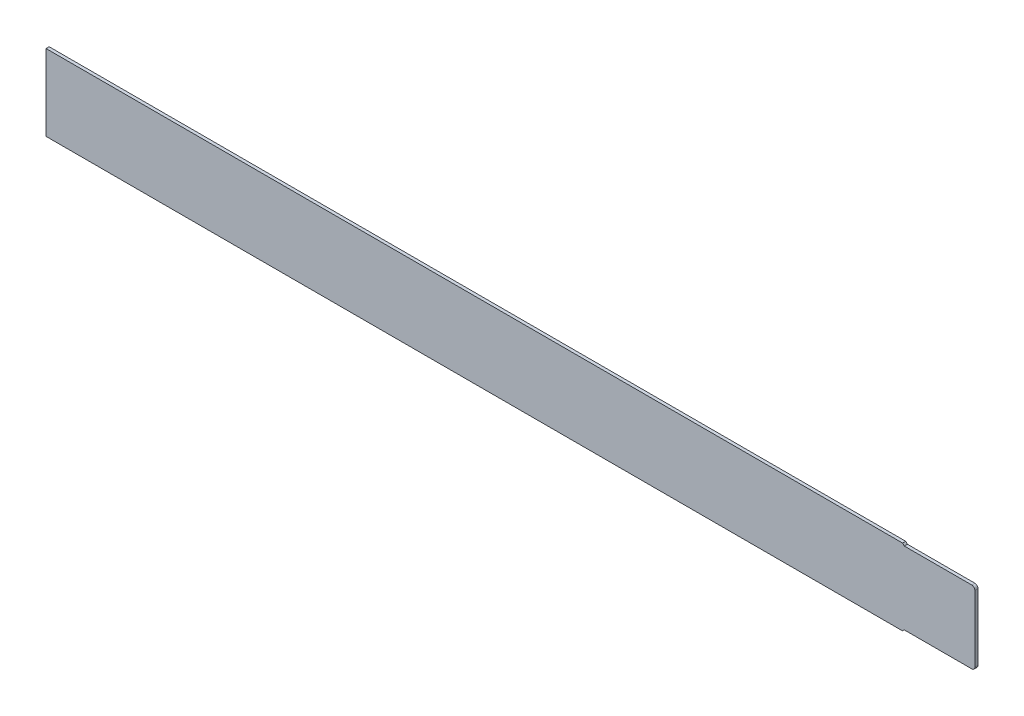
from build123d import *

# Parameters (mm, degrees)
BOSS_EXTRUDE1_DEPTH = 0.3
FILLET1_R           = 0.3
CHAMFER1_SIZE       = 0.2


with BuildPart() as part:
    # Sketch1 → Boss-Extrude1 (new body)
    with BuildSketch(Plane.XY):
        Polygon((0, 3.666), (-82.5, 3.666), (-82.5, -3.666), (0, -3.666), (0, -3.5), (7, -3.5), (7, 3.5), (0, 3.5), align=None)
    extrude(amount=BOSS_EXTRUDE1_DEPTH)

    # Fillet1
    fillet1_edges = [part.edges().sort_by_distance(p)[0] for p in [
        (7, 3.5, 0.15),
        (7, -3.5, 0.15),
    ]]
    fillet(fillet1_edges, radius=FILLET1_R)

    # Chamfer1
    # the kernel refuses this chamfer: 0.2 mm, written as the material it adds along each edge
    with BuildSketch(Plane(origin=(0, 3.5, 0), x_dir=(0.9996219169112966, -0.027495876610587326, 0), z_dir=(0, 0, 1))) as chamfer1_piece_1_section:
        Polygon((CHAMFER1_SIZE * 0.999621916911, CHAMFER1_SIZE * 0.0274958766106), (-CHAMFER1_SIZE * 0.0274958766106, CHAMFER1_SIZE * 0.999621916911), (0, 0), align=None)
    chamfer1_piece_1 = extrude(amount=0.3, mode=Mode.PRIVATE)
    chamfer1_piece_1 = split(chamfer1_piece_1, bisect_by=Plane(origin=(0.068475568, 3.666, 0.15), z_dir=(0, -1, 0)), keep=Keep.TOP, mode=Mode.PRIVATE)
    add(chamfer1_piece_1)
    with BuildSketch(Plane(origin=(0, -3.5, 0), x_dir=(0.9996219169112966, 0.02749587661058735, 0), z_dir=(0, 0, 1))) as chamfer1_piece_2_section:
        Polygon((CHAMFER1_SIZE * 0.999621916911, -CHAMFER1_SIZE * 0.0274958766106), (-CHAMFER1_SIZE * 0.0274958766106, -CHAMFER1_SIZE * 0.999621916911), (0, 0), align=None)
    chamfer1_piece_2 = extrude(amount=0.3, mode=Mode.PRIVATE)
    chamfer1_piece_2 = split(chamfer1_piece_2, bisect_by=Plane(origin=(0.068475568, -3.666, 0.15), z_dir=(0, 1, 0)), keep=Keep.TOP, mode=Mode.PRIVATE)
    add(chamfer1_piece_2)


solid = part.part
